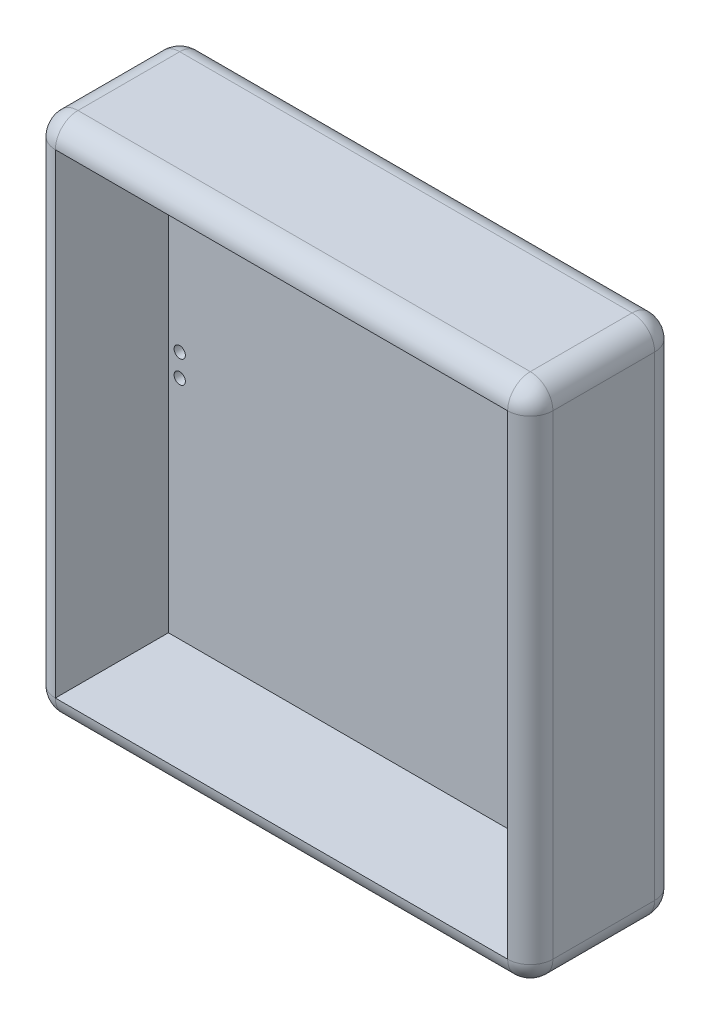
from build123d import *

# Parameters (mm, degrees)
SKETCH_1_W          = 40
SKETCH_1_H          = 42
EXTRUDE_1_DEPTH     = 10
SKETCH_2_W          = 44
SKETCH_2_H          = 46
EXTRUDE_2_DEPTH     = 3
FILLET_1_R          = 2
FILLET_2_R          = 2
FILLET_3_R          = 2
FILLET_4_R          = 2
FILLET_5_R          = 2
SKETCH_4_R          = 0.5
CUT_EXTRUDE_1_DEPTH = 3


# Some blends are built 0.0001 mm under size
with BuildPart() as part:
    # 草图1 → 凸台-拉伸1 (new body)
    with BuildSketch(Plane.XY):
        Polygon((-42, -2), (0, -2), (2, -2), (2, 44), (-42, 44), align=None)
        with Locations((-20, 21)):
            Rectangle(SKETCH_1_W, SKETCH_1_H, mode=Mode.SUBTRACT)
    extrude(amount=EXTRUDE_1_DEPTH)

    # 草图2 → 凸台-拉伸2 (add)
    with BuildSketch(Plane.XY):
        with Locations((-20, 21)):
            Rectangle(SKETCH_2_W, SKETCH_2_H)
    extrude(amount=-EXTRUDE_2_DEPTH)

    # 圆角1
    fillet_1_edges = [part.edges().sort_by_distance(p)[0] for p in [
        (-20, 44, -3),
    ]]
    fillet(fillet_1_edges, radius=FILLET_1_R)

    # 圆角2
    fillet_2_edges = [part.edges().sort_by_distance(p)[0] for p in [
        (2, 44, 4.5),
        (2, 20, -3),
        (2, 43.414213562, -2.414213562),
    ]]
    fillet(fillet_2_edges, radius=FILLET_2_R)

    # 圆角3
    fillet_3_edges = [part.edges().sort_by_distance(p)[0] for p in [
        (-42, -2, 3.5),
        (2, -2, 4.5),
        (-21, -2, -3),
        (1.414213562, -2, -2.414213562),
        (-20, -2, 10),
    ]]
    fillet(fillet_3_edges, radius=FILLET_3_R - 0.0001)  # a hair under: the kernel refuses the full size

    # 圆角4
    # the kernel refuses this fillet: 2 mm, written as the material it takes off along each edge
    with BuildSketch(Plane(origin=(0, -2, 8), x_dir=(1, 0, 0), z_dir=(0, 0, -1))) as fillet_4_piece_1:
        with BuildLine():
            CenterArc((0.0001, -1.9999), 1.9999, 0, 90)
            Line((2, -1.9999), (2, 0))
            Line((2, 0), (0.0001, 0))
        make_face()
    revolve(axis=Axis((0, -2, 8), (0, -1, 0)), revolution_arc=90, mode=Mode.SUBTRACT)
    with BuildSketch(Plane(origin=(0, 44, 10), x_dir=(0, -1, 0), z_dir=(-1, 0, 0))) as fillet_4_piece_2:
        with BuildLine():
            CenterArc((FILLET_4_R, -FILLET_4_R), FILLET_4_R, 90, 90)
            Line((0, -FILLET_4_R), (0, 0))
            Line((0, 0), (FILLET_4_R, 0))
        make_face()
    extrude(amount=47, mode=Mode.SUBTRACT)
    with BuildSketch(Plane(origin=(0, 42, 10), x_dir=(0, 1, 0), z_dir=(-1, 0, 0))) as fillet_4_piece_3:
        with BuildLine():
            CenterArc((2 - FILLET_4_R, FILLET_4_R), FILLET_4_R, 270, 90)
            Line((2, FILLET_4_R), (2, 0))
            Line((2, 0), (2 - FILLET_4_R, 0))
        make_face()
    revolve(axis=Axis((0, 42, 10), (0, 0, -1)), revolution_arc=90, mode=Mode.SUBTRACT)
    with BuildSketch(Plane(origin=(2, -2, 10), x_dir=(-1, 0, 0), z_dir=(0, 1, 0))) as fillet_4_piece_4:
        with BuildLine():
            CenterArc((FILLET_4_R, -FILLET_4_R), FILLET_4_R, 90, 90)
            Line((0, -FILLET_4_R), (0, 0))
            Line((0, 0), (FILLET_4_R, 0))
        make_face()
    extrude(amount=44, mode=Mode.SUBTRACT)

    # 圆角5
    # the kernel refuses this fillet: 2 mm, written as the material it takes off along each edge
    with BuildSketch(Plane(origin=(-40, -2, 8), x_dir=(0, 0, 1), z_dir=(1, 0, 0))) as fillet_5_piece_1:
        with BuildLine():
            CenterArc((0.0001, -1.9999), 1.9999, 0, 90)
            Line((2, -1.9999), (2, 0))
            Line((2, 0), (0.0001, 0))
        make_face()
    revolve(axis=Axis((-40, -2, 8), (0, -1, 0)), revolution_arc=90, mode=Mode.SUBTRACT)
    with BuildSketch(Plane(origin=(-40, -2, -1), x_dir=(-1, 0, 0), z_dir=(0, 0, 1))) as fillet_5_piece_2:
        with BuildLine():
            CenterArc((0.0001, -1.9999), 1.9999, 0, 90)
            Line((2, -1.9999), (2, 0))
            Line((2, 0), (0.0001, 0))
        make_face()
    revolve(axis=Axis((-40, -2, -1), (0, -1, 0)), revolution_arc=90, mode=Mode.SUBTRACT)
    with BuildSketch(Plane(origin=(-42, 42, 10), x_dir=(0, 0, -1), z_dir=(0, -1, 0)), Plane(origin=(-42, -2, -3), x_dir=(0, 0, 1), z_dir=(0, 1, 0))) as fillet_5_piece_3:
        with BuildLine():
            CenterArc((FILLET_5_R, FILLET_5_R), FILLET_5_R, 180, 90)
            Line((0, FILLET_5_R), (0, 0))
            Line((0, 0), (FILLET_5_R, 0))
        make_face()
    extrude(amount=44, mode=Mode.SUBTRACT)
    with BuildSketch(Plane(origin=(-42, 42, 8), x_dir=(0, 1, 0), z_dir=(0, 0, -1))) as fillet_5_piece_4:
        with BuildLine():
            CenterArc((2 - FILLET_5_R, FILLET_5_R), FILLET_5_R, 270, 90)
            Line((2, FILLET_5_R), (2, 0))
            Line((2, 0), (2 - FILLET_5_R, 0))
        make_face()
    revolve(axis=Axis((-42, 42, 8), (1, 0, 0)), revolution_arc=90, mode=Mode.SUBTRACT)
    with BuildSketch(Plane(origin=(-42, 44, -1), x_dir=(0, -1, 0), z_dir=(0, 0, 1))) as fillet_5_piece_5:
        with BuildLine():
            CenterArc((FILLET_5_R, FILLET_5_R), FILLET_5_R, 180, 90)
            Line((0, FILLET_5_R), (0, 0))
            Line((0, 0), (FILLET_5_R, 0))
        make_face()
    extrude(amount=9, mode=Mode.SUBTRACT)
    with BuildSketch(Plane(origin=(-42, 42, -1), x_dir=(0, 1, 0), z_dir=(0, 0, 1))) as fillet_5_piece_6:
        with BuildLine():
            CenterArc((2 - FILLET_5_R, -FILLET_5_R), FILLET_5_R, 0, 90)
            Line((2, -FILLET_5_R), (2, 0))
            Line((2, 0), (2 - FILLET_5_R, 0))
        make_face()
    revolve(axis=Axis((-42, 42, -1), (-1, 0, 0)), revolution_arc=90, mode=Mode.SUBTRACT)

    # 草图4 → 切除-拉伸1 (cut)
    with BuildSketch(Plane.XY):
        with Locations((-39, 22)):
            Circle(SKETCH_4_R)
        with Locations((-39, 20)):
            Circle(SKETCH_4_R)
    extrude(amount=-CUT_EXTRUDE_1_DEPTH, mode=Mode.SUBTRACT)


solid = part.part
